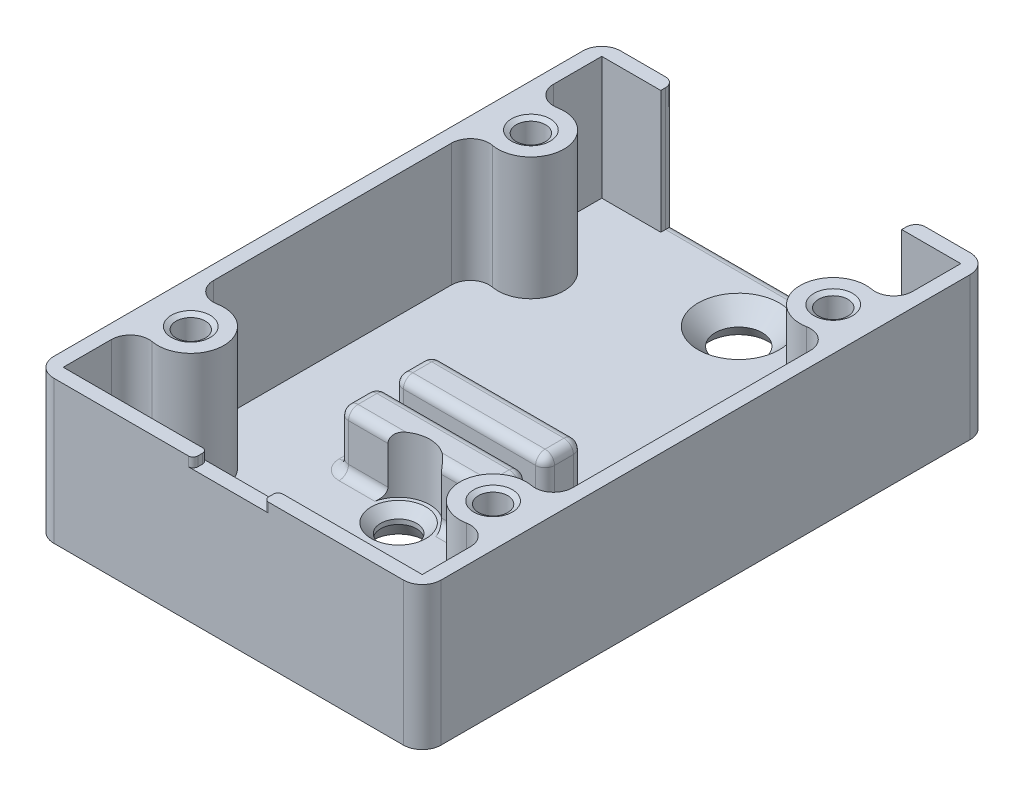
from build123d import *
from OCP.BRepFilletAPI import BRepFilletAPI_MakeChamfer

# Parameters (mm, degrees)
SKETCH_1_W          = 41
SKETCH_1_H          = 60
SKETCH_1_R          = 2.3
SKETCH_1_R_2        = 1.9
EXTRUDE_1_DEPTH     = 3
CHAMFER_1_SIZE      = 2
SKETCH_2_W          = 41
SKETCH_2_H          = 60
SKETCH_2_W_2        = 38
SKETCH_2_H_2        = 57
EXTRUDE_1_2_DEPTH   = 13
SKETCH_3_W          = 25.5
SKETCH_3_H          = 3.030341357
CUT_EXTRUDE_1_DEPTH = 13
SKETCH_4_R          = 3.5
EXTRUDE_2_DEPTH     = 13
SKETCH_5_R          = 1.55
CUT_EXTRUDE_2_DEPTH = 10
SKETCH_6_W          = 16
SKETCH_6_H          = 4
EXTRUDE_3_DEPTH     = 6
SKETCH_7_W          = 7.5
SKETCH_7_H          = 4.667229269
CUT_EXTRUDE_3_DEPTH = 1
FILLET_2_R          = 0.5
FILLET_3_R          = 2
CHAMFER_4_SIZE      = 0.866025404
CHAMFER_4_SIZE_2    = 1.5
FILLET_4_R          = 1
CHAMFER_6_SIZE      = 0.5
CHAMFER_6_SIZE2     = 0.288675135
FILLET_5_R          = 1
FILLET_7_R          = 2
CUT_EXTRUDE_5_REACH = 39.433
SKETCH_8_R          = 3.3
CHAMFER_8_SIZE      = 1


with BuildPart() as part:
    # Эскиз1 → Extrude 1 (new body)
    with BuildSketch(Plane(origin=(0, 0, 0), x_dir=(1, 0, 0), z_dir=(0, 1, 0))):
        Rectangle(SKETCH_1_W, SKETCH_1_H)
        with Locations(Location((0, 24, 0), (0, 0, 270))):
            Circle(SKETCH_1_R, mode=Mode.SUBTRACT)
        with Locations(Location((0, -24, 0), (0, 0, 270))):
            Circle(SKETCH_1_R, mode=Mode.SUBTRACT)
        with Locations(Location((0, -12, 0), (0, 0, 270))):
            Circle(SKETCH_1_R_2, mode=Mode.SUBTRACT)
    extrude(amount=EXTRUDE_1_DEPTH)

    # Фаска1
    chamfer_1_edges = [part.edges().sort_by_distance(p)[0] for p in [
        (0, 3, -26.3),
        (0, 3, 21.7),
    ]]
    chamfer(chamfer_1_edges, length=CHAMFER_1_SIZE)

    # Эскиз2 → Extrude 1 2 (add)
    with BuildSketch(Plane(origin=(0, 3, 0), x_dir=(1, 0, 0), z_dir=(0, 1, 0))):
        Rectangle(SKETCH_2_W, SKETCH_2_H)
        Rectangle(SKETCH_2_W_2, SKETCH_2_H_2, mode=Mode.SUBTRACT)
    extrude(amount=EXTRUDE_1_2_DEPTH)

    # Эскиз3 → Вырез-Вытянуть1 (cut)
    with BuildSketch(Plane(origin=(0, 16, 0), x_dir=(1, 0, 0), z_dir=(0, 1, 0))):
        with Locations((0, 29.478101209)):
            Rectangle(SKETCH_3_W, SKETCH_3_H)
    extrude(amount=-CUT_EXTRUDE_1_DEPTH, mode=Mode.SUBTRACT)

    # Эскиз4 → Бобышка-Вытянуть2 (add)
    with BuildSketch(Plane(origin=(0, 3, 0), x_dir=(1, 0, 0), z_dir=(0, 1, 0))):
        with Locations((16, 18)):
            Circle(SKETCH_4_R)
        with Locations((-16, 18)):
            Circle(SKETCH_4_R)
        with Locations((16, -18)):
            Circle(SKETCH_4_R)
        with Locations((-16, -18)):
            Circle(SKETCH_4_R)
    extrude(amount=EXTRUDE_2_DEPTH)

    # Эскиз5 → Вырез-Вытянуть2 (cut)
    with BuildSketch(Plane(origin=(0, 16, 0), x_dir=(1, 0, 0), z_dir=(0, 1, 0))):
        with Locations(Location((16, 18, 0), (0, 0, 270))):
            Circle(SKETCH_5_R)
        with Locations(Location((16, -18, 0), (0, 0, 270))):
            Circle(SKETCH_5_R)
        with Locations(Location((-16, -18, 0), (0, 0, 270))):
            Circle(SKETCH_5_R)
        with Locations(Location((-16, 18, 0), (0, 0, 270))):
            Circle(SKETCH_5_R)
    extrude(amount=-CUT_EXTRUDE_2_DEPTH, mode=Mode.SUBTRACT)

    # Эскиз6 → Бобышка-Вытянуть3 (add)
    with BuildSketch(Plane(origin=(0, 3, 0), x_dir=(1, 0, 0), z_dir=(0, 1, 0))):
        with Locations((0, -2.5)):
            Rectangle(SKETCH_6_W, SKETCH_6_H)
        with Locations((0, -8.3)):
            Rectangle(SKETCH_6_W, SKETCH_6_H)
    extrude(amount=EXTRUDE_3_DEPTH)

    # Эскиз7 → Вырез-Вытянуть3 (cut)
    with BuildSketch(Plane(origin=(0, 16, 0), x_dir=(1, 0, 0), z_dir=(0, 1, 0))):
        with Locations((0, -28.649225697)):
            Rectangle(SKETCH_7_W, SKETCH_7_H)
    extrude(amount=-CUT_EXTRUDE_3_DEPTH, mode=Mode.SUBTRACT)

    # Скругление2
    fillet_2_edges = [part.edges().sort_by_distance(p)[0] for p in [
        (-3.75, 15.5, 28.5),
        (3.75, 15.5, 28.5),
        (3.75, 15.5, 30),
        (-3.75, 15.5, 30),
    ]]
    fillet(fillet_2_edges, radius=FILLET_2_R)

    # Скругление3
    fillet_3_edges = [part.edges().sort_by_distance(p)[0] for p in [
        (20.5, 8, 30),
        (-20.5, 8, 30),
        (-20.5, 8, -30),
        (20.5, 8, -30),
    ]]
    fillet(fillet_3_edges, radius=FILLET_3_R)

    # Фаска4
    # the kernel refuses this chamfer: 1.5, 0.866025404 mm, written as the material it takes off along each edge
    with BuildSketch(Plane(origin=(0, 0, 24), x_dir=(0, 0, 1), z_dir=(-1, 0, 0))) as chamfer_4_piece_1:
        Polygon((2.3 + CHAMFER_4_SIZE, 0), (2.3, CHAMFER_4_SIZE_2), (2.3, 0), align=None)
    revolve(axis=Axis((0, 0, 24), (0, 1, 0)), mode=Mode.SUBTRACT)
    with BuildSketch(Plane(origin=(18.5, 0, -30), x_dir=(0, -0.01932676561270073, 0.999813220622208), z_dir=(-1, 0, 0))) as chamfer_4_piece_2:
        Polygon((CHAMFER_4_SIZE_2 * 0.999813220622, CHAMFER_4_SIZE_2 * 0.0193267656127), (-CHAMFER_4_SIZE * 0.0193267656079, CHAMFER_4_SIZE * 0.999813220373), (0, 0), align=None)
    extrude(amount=37, mode=Mode.SUBTRACT)
    with BuildSketch(Plane(origin=(-20.5, 0, -28), x_dir=(0.999813220622208, -0.01932676561270073, 0), z_dir=(0, 0, 1)), Plane(origin=(20.5, 0, 28), x_dir=(-0.999813220622208, -0.01932676561270073, 0), z_dir=(0, 0, -1))) as chamfer_4_piece_3:
        Polygon((CHAMFER_4_SIZE_2 * 0.999813220622, CHAMFER_4_SIZE_2 * 0.0193267656127), (-CHAMFER_4_SIZE * 0.0193267656079, CHAMFER_4_SIZE * 0.999813220373), (0, 0), align=None)
    extrude(amount=56, mode=Mode.SUBTRACT)
    with BuildSketch(Plane(origin=(-18.5, 0, 30), x_dir=(0, 0.9983227437537924, 0.0578938624026721), z_dir=(1, 0, 0))) as chamfer_4_piece_4:
        Polygon((CHAMFER_4_SIZE * 0.998322743505, -CHAMFER_4_SIZE * 0.0578938623883), (-CHAMFER_4_SIZE_2 * 0.0578938624027, -CHAMFER_4_SIZE_2 * 0.998322743754), (0, 0), align=None)
    extrude(amount=37, mode=Mode.SUBTRACT)
    with BuildSketch(Plane(origin=(-18.5, 0, -28), x_dir=(0, 0, -1), z_dir=(1, 0, 0))) as chamfer_4_piece_5:
        Polygon((2 - CHAMFER_4_SIZE_2, 0), (2, CHAMFER_4_SIZE), (2, 0), align=None)
    revolve(axis=Axis((-18.5, 0, -28), (0, 1, 0)), revolution_arc=90, mode=Mode.SUBTRACT)
    with BuildSketch(Plane(origin=(-18.5, 0, 28), x_dir=(0, 0, 1), z_dir=(1, 0, 0))) as chamfer_4_piece_6:
        Polygon((2 - CHAMFER_4_SIZE_2, 0), (2, -CHAMFER_4_SIZE), (2, 0), align=None)
    revolve(axis=Axis((-18.5, 0, 28), (0, -1, 0)), revolution_arc=90, mode=Mode.SUBTRACT)
    with BuildSketch(Plane(origin=(18.5, 0, 28), x_dir=(0, 0, 1), z_dir=(-1, 0, 0))) as chamfer_4_piece_7:
        Polygon((2, CHAMFER_4_SIZE), (2 - CHAMFER_4_SIZE_2, 0), (2, 0), align=None)
    revolve(axis=Axis((18.5, 0, 28), (0, 1, 0)), revolution_arc=90, mode=Mode.SUBTRACT)
    with BuildSketch(Plane(origin=(18.5, 0, -28), x_dir=(0, 0, -1), z_dir=(-1, 0, 0))) as chamfer_4_piece_8:
        Polygon((2 - CHAMFER_4_SIZE_2, 0), (2, -CHAMFER_4_SIZE), (2, 0), align=None)
    revolve(axis=Axis((18.5, 0, -28), (0, -1, 0)), revolution_arc=90, mode=Mode.SUBTRACT)
    with BuildSketch(Plane(origin=(0, 0, -24), x_dir=(0, 0, 1), z_dir=(-1, 0, 0))) as chamfer_4_piece_9:
        Polygon((2.3 + CHAMFER_4_SIZE, 0), (2.3, CHAMFER_4_SIZE_2), (2.3, 0), align=None)
    revolve(axis=Axis((0, 0, -24), (0, 1, 0)), mode=Mode.SUBTRACT)
    with BuildSketch(Plane(origin=(0, 0, 12), x_dir=(0, 0, 1), z_dir=(-1, 0, 0))) as chamfer_4_piece_10:
        Polygon((1.9 + CHAMFER_4_SIZE, 0), (1.9, CHAMFER_4_SIZE_2), (1.9, 0), align=None)
    revolve(axis=Axis((0, 0, 12), (0, 1, 0)), mode=Mode.SUBTRACT)

    # Скругление4
    # the kernel refuses this fillet: 1 mm, written as the material it takes off along each edge
    with BuildSketch(Plane(origin=(-7, 8, 1.5), x_dir=(-1, 0, 0), z_dir=(0, 1, 0))) as fillet_4_piece_1_section:
        Polygon((0, 0), (FILLET_4_R * 1.02, 0), (FILLET_4_R * 1.02, -FILLET_4_R * 1.02), (0, -FILLET_4_R * 1.02), align=None)
    fillet_4_piece_1 = extrude(amount=FILLET_4_R * 1.02, mode=Mode.PRIVATE)
    fillet_4_piece_1 = fillet_4_piece_1 - Plane(origin=(-7, 8, 1.5), x_dir=(0.7071067811865474, 0, 0.7071067811865477), z_dir=(0, 1, 0)) * Sphere(FILLET_4_R, mode=Mode.PRIVATE)
    add(fillet_4_piece_1, mode=Mode.SUBTRACT)
    with BuildSketch(Plane(origin=(-7, 8, 3.5), x_dir=(-1, 0, 0), z_dir=(0, 1, 0))) as fillet_4_piece_2_section:
        Polygon((0, 0), (FILLET_4_R * 1.02, 0), (FILLET_4_R * 1.02, FILLET_4_R * 1.02), (0, FILLET_4_R * 1.02), align=None)
    fillet_4_piece_2 = extrude(amount=FILLET_4_R * 1.02, mode=Mode.PRIVATE)
    fillet_4_piece_2 = fillet_4_piece_2 - Plane(origin=(-7, 8, 3.5), x_dir=(0.7071067811865475, 0, -0.7071067811865476), z_dir=(0, 1, 0)) * Sphere(FILLET_4_R, mode=Mode.PRIVATE)
    add(fillet_4_piece_2, mode=Mode.SUBTRACT)
    with BuildSketch(Plane(origin=(7, 8, 3.5), x_dir=(0, 0, 1), z_dir=(0, 1, 0))) as fillet_4_piece_3_section:
        Polygon((0, 0), (FILLET_4_R * 1.02, 0), (FILLET_4_R * 1.02, FILLET_4_R * 1.02), (0, FILLET_4_R * 1.02), align=None)
    fillet_4_piece_3 = extrude(amount=FILLET_4_R * 1.02, mode=Mode.PRIVATE)
    fillet_4_piece_3 = fillet_4_piece_3 - Plane(origin=(7, 8, 3.5), x_dir=(-0.7071067811865478, 0, -0.7071067811865472), z_dir=(0, 1, 0)) * Sphere(FILLET_4_R, mode=Mode.PRIVATE)
    add(fillet_4_piece_3, mode=Mode.SUBTRACT)
    with BuildSketch(Plane(origin=(7, 8, 1.5), x_dir=(1, 0, 0), z_dir=(0, 1, 0))) as fillet_4_piece_4_section:
        Polygon((0, 0), (FILLET_4_R * 1.02, 0), (FILLET_4_R * 1.02, FILLET_4_R * 1.02), (0, FILLET_4_R * 1.02), align=None)
    fillet_4_piece_4 = extrude(amount=FILLET_4_R * 1.02, mode=Mode.PRIVATE)
    fillet_4_piece_4 = fillet_4_piece_4 - Plane(origin=(7, 8, 1.5), x_dir=(-0.7071067811865476, 0, 0.7071067811865476), z_dir=(0, 1, 0)) * Sphere(FILLET_4_R, mode=Mode.PRIVATE)
    add(fillet_4_piece_4, mode=Mode.SUBTRACT)
    with BuildSketch(Plane(origin=(-7, 8, 7.3), x_dir=(0, 0, -1), z_dir=(0, 1, 0))) as fillet_4_piece_5_section:
        Polygon((0, 0), (FILLET_4_R * 1.02, 0), (FILLET_4_R * 1.02, FILLET_4_R * 1.02), (0, FILLET_4_R * 1.02), align=None)
    fillet_4_piece_5 = extrude(amount=FILLET_4_R * 1.02, mode=Mode.PRIVATE)
    fillet_4_piece_5 = fillet_4_piece_5 - Plane(origin=(-7, 8, 7.3), x_dir=(0.7071067811865475, 0, 0.7071067811865475), z_dir=(0, 1, 0)) * Sphere(FILLET_4_R, mode=Mode.PRIVATE)
    add(fillet_4_piece_5, mode=Mode.SUBTRACT)
    with BuildSketch(Plane(origin=(-7, 8, 9.3), x_dir=(-1, 0, 0), z_dir=(0, 1, 0))) as fillet_4_piece_6_section:
        Polygon((0, 0), (FILLET_4_R * 1.02, 0), (FILLET_4_R * 1.02, FILLET_4_R * 1.02), (0, FILLET_4_R * 1.02), align=None)
    fillet_4_piece_6 = extrude(amount=FILLET_4_R * 1.02, mode=Mode.PRIVATE)
    fillet_4_piece_6 = fillet_4_piece_6 - Plane(origin=(-7, 8, 9.3), x_dir=(0.7071067811865475, 0, -0.7071067811865475), z_dir=(0, 1, 0)) * Sphere(FILLET_4_R, mode=Mode.PRIVATE)
    add(fillet_4_piece_6, mode=Mode.SUBTRACT)
    with BuildSketch(Plane(origin=(7, 8, 9.3), x_dir=(0, 1, 0), z_dir=(1, 0, 0))) as fillet_4_piece_7_section:
        Polygon((0, 0), (FILLET_4_R * 1.02, 0), (FILLET_4_R * 1.02, FILLET_4_R * 1.02), (0, FILLET_4_R * 1.02), align=None)
    fillet_4_piece_7 = extrude(amount=FILLET_4_R * 1.02, mode=Mode.PRIVATE)
    fillet_4_piece_7 = fillet_4_piece_7 - Plane(origin=(7, 8, 9.3), x_dir=(0, -0.7071067811865475, -0.7071067811865475), z_dir=(1, 0, 0)) * Sphere(FILLET_4_R, mode=Mode.PRIVATE)
    add(fillet_4_piece_7, mode=Mode.SUBTRACT)
    with BuildSketch(Plane(origin=(7, 8, 7.3), x_dir=(0, 0, -1), z_dir=(1, 0, 0))) as fillet_4_piece_8_section:
        Polygon((0, 0), (FILLET_4_R * 1.02, 0), (FILLET_4_R * 1.02, FILLET_4_R * 1.02), (0, FILLET_4_R * 1.02), align=None)
    fillet_4_piece_8 = extrude(amount=FILLET_4_R * 1.02, mode=Mode.PRIVATE)
    fillet_4_piece_8 = fillet_4_piece_8 - Plane(origin=(7, 8, 7.3), x_dir=(0, -0.7071067811865475, 0.7071067811865475), z_dir=(1, 0, 0)) * Sphere(FILLET_4_R, mode=Mode.PRIVATE)
    add(fillet_4_piece_8, mode=Mode.SUBTRACT)
    with BuildSketch(Plane(origin=(-8, 3, 0.5), x_dir=(0, 0, 1), z_dir=(0, 1, 0)), Plane(origin=(-8, 3, 10.3), x_dir=(1, 0, 0), z_dir=(0, 1, 0))) as fillet_4_piece_9:
        with BuildLine():
            CenterArc((FILLET_4_R, FILLET_4_R), FILLET_4_R, 180, 90)
            Line((0, FILLET_4_R), (0, 0))
            Line((0, 0), (FILLET_4_R, 0))
        make_face()
    extrude(amount=5, mode=Mode.SUBTRACT)
    with BuildSketch(Plane(origin=(-8, 3, 4.5), x_dir=(0, 0, -1), z_dir=(0, 1, 0)), Plane(origin=(8, 3, 4.5), x_dir=(-1, 0, 0), z_dir=(0, 1, 0)), Plane(origin=(8, 3, 0.5), x_dir=(0, 0, 1), z_dir=(0, 1, 0)), Plane(origin=(-8, 3, 6.3), x_dir=(1, 0, 0), z_dir=(0, 1, 0)), Plane(origin=(8, 3, 10.3), x_dir=(-1, 0, 0), z_dir=(0, 1, 0)), Plane(origin=(8, 3, 6.3), x_dir=(0, 0, 1), z_dir=(0, 1, 0))) as fillet_4_piece_10:
        with BuildLine():
            CenterArc((FILLET_4_R, -FILLET_4_R), FILLET_4_R, 90, 90)
            Line((0, -FILLET_4_R), (0, 0))
            Line((0, 0), (FILLET_4_R, 0))
        make_face()
    extrude(amount=5, mode=Mode.SUBTRACT)
    with BuildSketch(Plane(origin=(-8, 9, 3.5), x_dir=(0, -1, 0), z_dir=(0, 0, -1)), Plane(origin=(8, 9, 1.5), x_dir=(0, -1, 0), z_dir=(0, 0, 1)), Plane(origin=(-8, 9, 9.3), x_dir=(0, -1, 0), z_dir=(0, 0, -1)), Plane(origin=(8, 9, 7.3), x_dir=(0, -1, 0), z_dir=(0, 0, 1))) as fillet_4_piece_11:
        with BuildLine():
            CenterArc((FILLET_4_R, -FILLET_4_R), FILLET_4_R, 90, 90)
            Line((0, -FILLET_4_R), (0, 0))
            Line((0, 0), (FILLET_4_R, 0))
        make_face()
    extrude(amount=2, mode=Mode.SUBTRACT)
    with BuildSketch(Plane(origin=(7, 9, 4.5), x_dir=(0, -1, 0), z_dir=(-1, 0, 0)), Plane(origin=(-7, 9, 0.5), x_dir=(0, -1, 0), z_dir=(1, 0, 0)), Plane(origin=(7, 9, 10.3), x_dir=(0, -1, 0), z_dir=(-1, 0, 0)), Plane(origin=(-7, 9, 6.3), x_dir=(0, -1, 0), z_dir=(1, 0, 0))) as fillet_4_piece_12:
        with BuildLine():
            CenterArc((FILLET_4_R, -FILLET_4_R), FILLET_4_R, 90, 90)
            Line((0, -FILLET_4_R), (0, 0))
            Line((0, 0), (FILLET_4_R, 0))
        make_face()
    extrude(amount=14, mode=Mode.SUBTRACT)
    # the kernel refuses this fillet: 1 mm, written as the material it adds along each edge
    with BuildSketch(Plane(origin=(-8, 3, 3.5), x_dir=(-1, 0, 0), z_dir=(0, 0, -1)), Plane(origin=(8, 3, 1.5), x_dir=(1, 0, 0), z_dir=(0, 0, 1)), Plane(origin=(-8, 3, 9.3), x_dir=(-1, 0, 0), z_dir=(0, 0, -1)), Plane(origin=(8, 3, 7.3), x_dir=(1, 0, 0), z_dir=(0, 0, 1))) as fillet_4_2_piece_1:
        with BuildLine():
            CenterArc((FILLET_4_R, FILLET_4_R), FILLET_4_R, 180, 90)
            Line((0, FILLET_4_R), (0, 0))
            Line((0, 0), (FILLET_4_R, 0))
        make_face()
    extrude(amount=2)
    with BuildSketch(Plane(origin=(7, 3, 4.5), x_dir=(0, 0, 1), z_dir=(-1, 0, 0)), Plane(origin=(-7, 3, 0.5), x_dir=(0, 0, -1), z_dir=(1, 0, 0)), Plane(origin=(-7, 3, 6.3), x_dir=(0, 0, -1), z_dir=(1, 0, 0))) as fillet_4_2_piece_2:
        with BuildLine():
            CenterArc((FILLET_4_R, FILLET_4_R), FILLET_4_R, 180, 90)
            Line((0, FILLET_4_R), (0, 0))
            Line((0, 0), (FILLET_4_R, 0))
        make_face()
    extrude(amount=14)
    with BuildSketch(Plane(origin=(1.651471863, 3, 10.3), x_dir=(0, 0, 1), z_dir=(-1, 0, 0))) as fillet_4_2_piece_3_section:
        with BuildLine():
            CenterArc((FILLET_4_R, FILLET_4_R), FILLET_4_R, 180, 90)
            Line((0, FILLET_4_R), (0, 0))
            Line((0, 0), (FILLET_4_R, 0))
        make_face()
    fillet_4_2_piece_3 = extrude(amount=8.651471863, mode=Mode.PRIVATE)
    fillet_4_2_piece_3 = fillet_4_2_piece_3 - Plane(origin=(0, 3.2735227, 12), x_dir=(0, 0, 1), z_dir=(0, -1, 0)) * Cylinder(1.9, 22, mode=Mode.PRIVATE)
    add(fillet_4_2_piece_3)
    with BuildSketch(Plane(origin=(7, 3, 10.3), x_dir=(0, 0, 1), z_dir=(-1, 0, 0))) as fillet_4_2_piece_4_section:
        with BuildLine():
            CenterArc((FILLET_4_R, FILLET_4_R), FILLET_4_R, 180, 90)
            Line((0, FILLET_4_R), (0, 0))
            Line((0, 0), (FILLET_4_R, 0))
        make_face()
    fillet_4_2_piece_4 = extrude(amount=8.651471863, mode=Mode.PRIVATE)
    fillet_4_2_piece_4 = fillet_4_2_piece_4 - Plane(origin=(0, 3.227598029, 12), x_dir=(0, 0, 1), z_dir=(0, -1, 0)) * Cylinder(1.9, 22, mode=Mode.PRIVATE)
    add(fillet_4_2_piece_4)
    with BuildSketch(Plane(origin=(-7, 3, 7.3), x_dir=(0, 0, -1), z_dir=(1, 0, 0))) as fillet_4_2_piece_5:
        with BuildLine():
            CenterArc((1 + FILLET_4_R, FILLET_4_R), FILLET_4_R, 180, 90)
            Line((1, FILLET_4_R), (1, 0))
            Line((1, 0), (1 + FILLET_4_R, 0))
        make_face()
    revolve(axis=Axis((-7, 3, 7.3), (0, 1, 0)), revolution_arc=90)
    with BuildSketch(Plane(origin=(7, 3, 7.3), x_dir=(1, 0, 0), z_dir=(0, 0, 1))) as fillet_4_2_piece_6:
        with BuildLine():
            CenterArc((1 + FILLET_4_R, FILLET_4_R), FILLET_4_R, 180, 90)
            Line((1, FILLET_4_R), (1, 0))
            Line((1, 0), (1 + FILLET_4_R, 0))
        make_face()
    revolve(axis=Axis((7, 3, 7.3), (0, 1, 0)), revolution_arc=90)
    with BuildSketch(Plane(origin=(7, 3, 9.3), x_dir=(0, 0, 1), z_dir=(-1, 0, 0))) as fillet_4_2_piece_7:
        with BuildLine():
            CenterArc((1 + FILLET_4_R, FILLET_4_R), FILLET_4_R, 180, 90)
            Line((1, FILLET_4_R), (1, 0))
            Line((1, 0), (1 + FILLET_4_R, 0))
        make_face()
    revolve(axis=Axis((7, 3, 9.3), (0, 1, 0)), revolution_arc=90)
    with BuildSketch(Plane(origin=(-7, 3, 9.3), x_dir=(0, 0, 1), z_dir=(1, 0, 0))) as fillet_4_2_piece_8:
        with BuildLine():
            CenterArc((1 + FILLET_4_R, -FILLET_4_R), FILLET_4_R, 90, 90)
            Line((1, -FILLET_4_R), (1, 0))
            Line((1, 0), (1 + FILLET_4_R, 0))
        make_face()
    revolve(axis=Axis((-7, 3, 9.3), (0, -1, 0)), revolution_arc=90)
    with BuildSketch(Plane(origin=(-7, 3, 1.5), x_dir=(-1, 0, 0), z_dir=(0, 0, 1))) as fillet_4_2_piece_9:
        with BuildLine():
            CenterArc((1 + FILLET_4_R, -FILLET_4_R), FILLET_4_R, 90, 90)
            Line((1, -FILLET_4_R), (1, 0))
            Line((1, 0), (1 + FILLET_4_R, 0))
        make_face()
    revolve(axis=Axis((-7, 3, 1.5), (0, -1, 0)), revolution_arc=90)
    with BuildSketch(Plane(origin=(7, 3, 1.5), x_dir=(1, 0, 0), z_dir=(0, 0, 1))) as fillet_4_2_piece_10:
        with BuildLine():
            CenterArc((1 + FILLET_4_R, FILLET_4_R), FILLET_4_R, 180, 90)
            Line((1, FILLET_4_R), (1, 0))
            Line((1, 0), (1 + FILLET_4_R, 0))
        make_face()
    revolve(axis=Axis((7, 3, 1.5), (0, 1, 0)), revolution_arc=90)
    with BuildSketch(Plane(origin=(7, 3, 3.5), x_dir=(0, 0, 1), z_dir=(-1, 0, 0))) as fillet_4_2_piece_11:
        with BuildLine():
            CenterArc((1 + FILLET_4_R, FILLET_4_R), FILLET_4_R, 180, 90)
            Line((1, FILLET_4_R), (1, 0))
            Line((1, 0), (1 + FILLET_4_R, 0))
        make_face()
    revolve(axis=Axis((7, 3, 3.5), (0, 1, 0)), revolution_arc=90)
    with BuildSketch(Plane(origin=(-7, 3, 3.5), x_dir=(-1, 0, 0), z_dir=(0, 0, -1))) as fillet_4_2_piece_12:
        with BuildLine():
            CenterArc((1 + FILLET_4_R, FILLET_4_R), FILLET_4_R, 180, 90)
            Line((1, FILLET_4_R), (1, 0))
            Line((1, 0), (1 + FILLET_4_R, 0))
        make_face()
    revolve(axis=Axis((-7, 3, 3.5), (0, 1, 0)), revolution_arc=90)

    # Фаска6: one chamfer whose edges measure the first distance from different faces: ONE call of the kernel's chamfer builder (chamfer() names one face for all edges)
    chamfer_6_edges_1 = [part.edges().sort_by_distance(p)[0] for p in [
        (-16, 16, -19.55),
        (-16, 16, 16.45),
    ]]
    chamfer_6_side_1 = [part.faces().sort_by_distance(p)[0] for p in [
        (-11.375, 16, 29.37705839),
    ]]
    chamfer_6_edges_2 = [part.edges().sort_by_distance(p)[0] for p in [
        (16, 16, 16.45),
        (16, 16, -19.55),
    ]]
    chamfer_6_side_2 = [part.faces().sort_by_distance(p)[0] for p in [
        (11.375, 16, 29.37705839),
    ]]
    chamfer_6 = BRepFilletAPI_MakeChamfer(part.part.solid().wrapped)
    for e in chamfer_6_edges_1:
        chamfer_6.Add(CHAMFER_6_SIZE, CHAMFER_6_SIZE2, e.wrapped, chamfer_6_side_1[0].wrapped)  # the first distance lies on this face
    for e in chamfer_6_edges_2:
        chamfer_6.Add(CHAMFER_6_SIZE, CHAMFER_6_SIZE2, e.wrapped, chamfer_6_side_2[0].wrapped)  # the first distance lies on this face
    add(Compound.cast(chamfer_6.Shape()), mode=Mode.REPLACE)

    # Скругление5
    fillet_5_edges = [part.edges().sort_by_distance(p)[0] for p in [
        (0, 3, -30),
        (-12.75, 9.5, -30),
        (12.75, 9.5, -30),
    ]]
    fillet(fillet_5_edges, radius=FILLET_5_R)

    # Скругление7
    fillet_7_edges = [part.edges().sort_by_distance(p)[0] for p in [
        (19, 9.5, 16.197224362),
        (19, 9.5, 19.802775638),
        (-19, 9.5, 19.802775638),
        (-19, 9.5, 16.197224362),
        (19, 9.5, -16.197224362),
        (19, 9.5, -19.802775638),
        (-19, 9.5, -19.802775638),
        (-19, 9.5, -16.197224362),
    ]]
    fillet(fillet_7_edges, radius=FILLET_7_R)

    # Вырез-Вытянуть5: up to this face of the body (flat: up to its plane)
    cut_extrude_5_end = Plane(part.part.faces().sort_by_distance((0, 3, -0.940940424))[0])
    # Эскиз8 → Вырез-Вытянуть5 (cut, up to the picked face)
    with BuildSketch(Plane(origin=(0, 9, 0), x_dir=(1, 0, 0), z_dir=(0, 1, 0)), mode=Mode.PRIVATE) as cut_extrude_5_sk1:
        with Locations((0, -12)):
            Circle(SKETCH_8_R)
    cut_extrude_5_tool1 = split(extrude(cut_extrude_5_sk1.sketch, amount=-CUT_EXTRUDE_5_REACH, mode=Mode.PRIVATE), bisect_by=cut_extrude_5_end, keep=Keep.BOTH, mode=Mode.PRIVATE)
    add(cut_extrude_5_tool1.solids().sort_by(Axis((0, 9, 12), (0, -1, 0)))[0], mode=Mode.SUBTRACT)

    # Фаска8
    chamfer_8_edges = [part.edges().sort_by_distance(p)[0] for p in [
        (0, 3, 10.1),
    ]]
    chamfer(chamfer_8_edges, length=CHAMFER_8_SIZE)


solid = part.part
